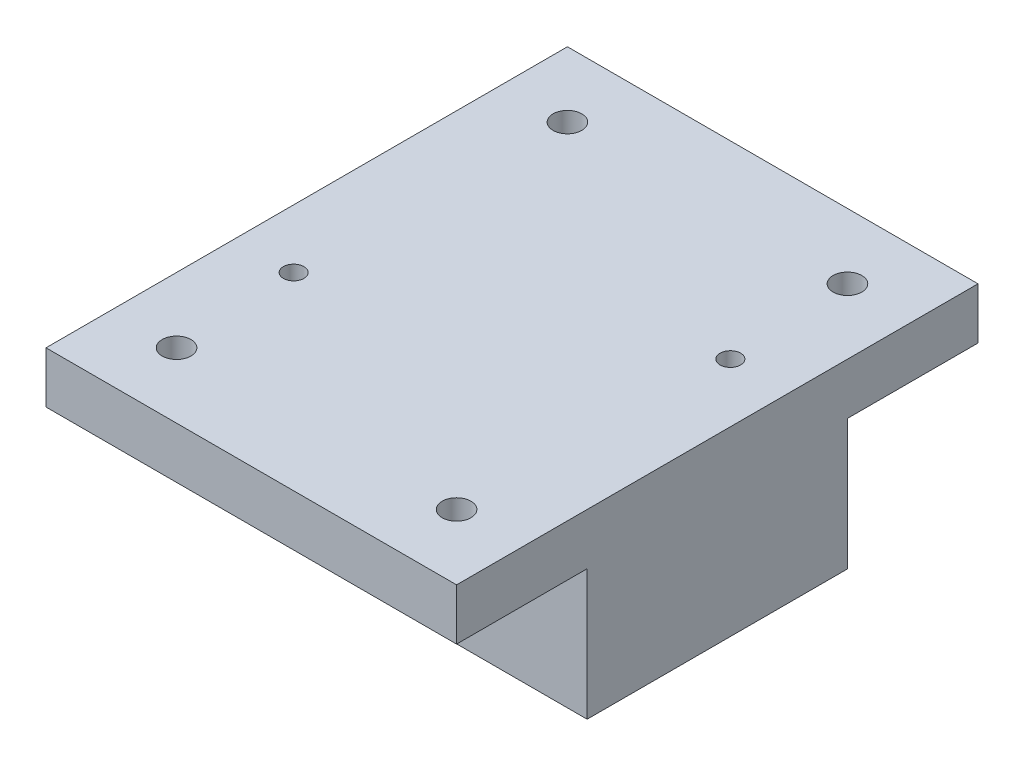
from build123d import *

# Parameters (mm, degrees)
SKETCH1_W           = 80
SKETCH1_H           = 101.6
SKETCH1_R           = 2.8
BOSS_EXTRUDE1_DEPTH = 10
SKETCH1_3_W         = 80
SKETCH1_3_H         = 50.725
BOSS_EXTRUDE2_DEPTH = 25.4
SKETCH2_R           = 2
CUT_EXTRUDE1_DEPTH  = 74.7143134


with BuildPart() as part:
    # Sketch1 → Boss-Extrude1 (new body)
    with BuildSketch(Plane(origin=(0, 0, 0), x_dir=(1, 0, 0), z_dir=(0, 1, 0))):
        Rectangle(SKETCH1_W, SKETCH1_H)
        with Locations((27.28125, 38.08125)):
            Circle(SKETCH1_R, mode=Mode.SUBTRACT)
        with Locations((-27.28125, 38.08125)):
            Circle(SKETCH1_R, mode=Mode.SUBTRACT)
        with Locations((27.28125, -38.08125)):
            Circle(SKETCH1_R, mode=Mode.SUBTRACT)
        with Locations((-27.28125, -38.08125)):
            Circle(SKETCH1_R, mode=Mode.SUBTRACT)
    extrude(amount=BOSS_EXTRUDE1_DEPTH)

    # Sketch1<3> → Boss-Extrude2 (add)
    with BuildSketch(Plane(origin=(0, 0, 0), x_dir=(1, 0, 0), z_dir=(0, 1, 0))):
        Rectangle(SKETCH1_3_W, SKETCH1_3_H)
    extrude(amount=-BOSS_EXTRUDE2_DEPTH)

    # Sketch2 → Cut-Extrude1 (cut, through all)
    with BuildSketch(Plane(origin=(0, 10, 0), x_dir=(1, 0, 0), z_dir=(0, 1, 0))):
        with Locations((-28.575, -13.97)):
            Circle(SKETCH2_R)
        with Locations((28.575, 13.97)):
            Circle(SKETCH2_R)
    extrude(amount=-CUT_EXTRUDE1_DEPTH, mode=Mode.SUBTRACT)


solid = part.part
